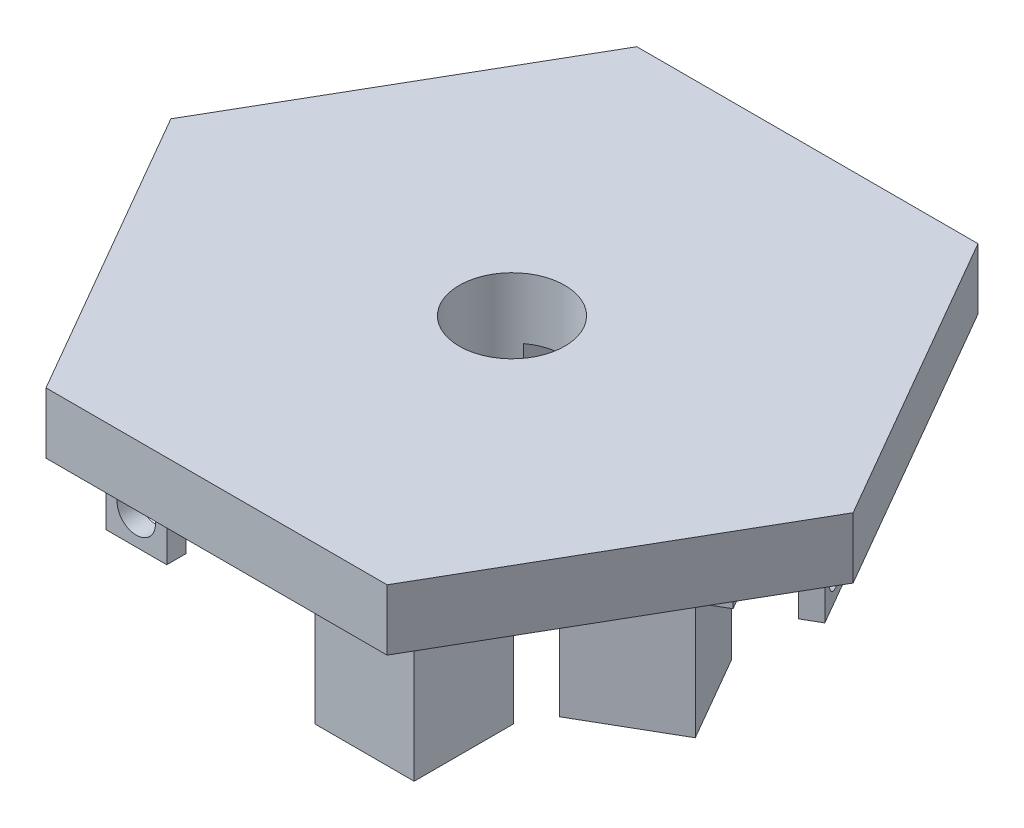
from build123d import *

# Parameters (mm, degrees)
BOSS_EXTRUDE1_DEPTH = 6.35
SKETCH6_R           = 5.5
CUT_EXTRUDE1_DEPTH  = 48.468108241
SKETCH2_W           = 6.35
SKETCH2_H           = 6.35
BOSS_EXTRUDE2_DEPTH = 25.4
SKETCH7_W           = 6.35
SKETCH7_H           = 2
BOSS_EXTRUDE3_DEPTH = 6.35
SKETCH9_R           = 2
CUT_EXTRUDE2_DEPTH  = 9.588
CIRPATTERN1_COUNT   = 3


with BuildPart() as part:
    # Sketch1 → Boss-Extrude1 (new body)
    with BuildSketch(Plane(origin=(0, 0, 0), x_dir=(1, 0, 0), z_dir=(0, 1, 0))):
        Polygon((17.78, -30.795863359), (35.56, 0), (17.78, 30.795863359), (-17.78, 30.795863359), (-35.56, 0), (-17.78, -30.795863359), align=None)
    extrude(amount=BOSS_EXTRUDE1_DEPTH)

    # Sketch6 → Cut-Extrude1 (cut, through all)
    with BuildSketch(Plane(origin=(0, 6.35, 0), x_dir=(1, 0, 0), z_dir=(0, 1, 0))):
        Circle(SKETCH6_R)
    extrude(amount=-CUT_EXTRUDE1_DEPTH, mode=Mode.SUBTRACT)

    # Sketch2 → Boss-Extrude2 (add)
    # profile 1 of 3: a face of its own
    with BuildSketch(Plane.XZ):
        with BuildLine():
            Line((-5.175, 15.374), (-5.175, 5.024))
            Line((-5.175, 5.024), (-2.238174256, 5.024))
            ThreePointArc((-2.238174256, 5.024), (0, 5.5), (2.238174256, 5.024))
            Line((2.238174256, 5.024), (5.175, 5.024))
            Line((5.175, 5.024), (5.175, 15.374))
            Line((5.175, 15.374), (-5.175, 15.374))
        make_face()
        with Locations((0, 10.199)):
            Rectangle(SKETCH2_W, SKETCH2_H, mode=Mode.SUBTRACT)
    # profile 2 of 3: a face of its own
    with BuildSketch(Plane.XZ):
        with BuildLine():
            Line((3.231824501, -4.450315764), (1.763411629, -6.993681465))
            Line((1.763411629, -6.993681465), (10.726774558, -12.168681465))
            Line((10.726774558, -12.168681465), (15.901774558, -3.205318535))
            Line((15.901774558, -3.205318535), (6.938411629, 1.969681465))
            Line((6.938411629, 1.969681465), (5.469998757, -0.573684236))
            ThreePointArc((5.469998757, -0.573684236), (4.763139721, -2.75), (3.231824501, -4.450315764))
        make_face()
        Polygon((13.16972375, -3.937369343), (7.670462436, -0.762369343), (4.495462436, -6.261630657), (9.99472375, -9.436630657), align=None, mode=Mode.SUBTRACT)
    # profile 3 of 3: a face of its own
    with BuildSketch(Plane.XZ):
        with BuildLine():
            Line((-5.469998757, -0.573684236), (-6.938411629, 1.969681465))
            Line((-6.938411629, 1.969681465), (-15.901774558, -3.205318535))
            Line((-15.901774558, -3.205318535), (-10.726774558, -12.168681465))
            Line((-10.726774558, -12.168681465), (-1.763411629, -6.993681465))
            Line((-1.763411629, -6.993681465), (-3.231824501, -4.450315764))
            ThreePointArc((-3.231824501, -4.450315764), (-4.763139721, -2.75), (-5.469998757, -0.573684236))
        make_face()
        Polygon((-9.99472375, -9.436630657), (-4.495462436, -6.261630657), (-7.670462436, -0.762369343), (-13.16972375, -3.937369343), align=None, mode=Mode.SUBTRACT)
    extrude(amount=BOSS_EXTRUDE2_DEPTH)

    # Sketch7 → Boss-Extrude3 (add)
    with BuildSketch(Plane.XZ):
        with Locations((-11.390300372, 19.7726)):
            Rectangle(SKETCH7_W, SKETCH7_H)
        with Locations((-11.390300372, 26.7726)):
            Rectangle(SKETCH7_W, SKETCH7_H)
        Polygon((25.272249489, 2.227620136), (22.097249489, -3.271641178), (20.365198681, -2.271641178), (23.540198681, 3.227620136), align=None)
        Polygon((29.602376508, -0.272379864), (31.334427315, -1.272379864), (28.159427315, -6.771641178), (26.427376508, -5.771641178), align=None)
        Polygon((-10.706949117, -23.000220136), (-13.881949117, -17.500958822), (-12.149898309, -16.500958822), (-8.974898309, -22.000220136), align=None)
        Polygon((-15.037076136, -25.500220136), (-16.769126943, -26.500220136), (-19.944126943, -21.000958822), (-18.212076136, -20.000958822), align=None)
    extrude(amount=BOSS_EXTRUDE3_DEPTH)

    # Sketch9 → Cut-Extrude2 (cut)
    with BuildSketch(Plane.XY.offset(27.7726)):
        with Locations((-11.390300372, -3.262620176)):
            Circle(SKETCH9_R)
    cut_extrude2 = extrude(amount=-CUT_EXTRUDE2_DEPTH, mode=Mode.SUBTRACT)

    # CirPattern1: Cut-Extrude2 ×3 about axis
    cirpattern1_axis = Axis((0, 0, 0), (0, 1, 0))
    for i in range(1, CIRPATTERN1_COUNT):
        add(cut_extrude2.rotate(cirpattern1_axis, i * 360 / CIRPATTERN1_COUNT), mode=Mode.SUBTRACT)


solid = part.part
